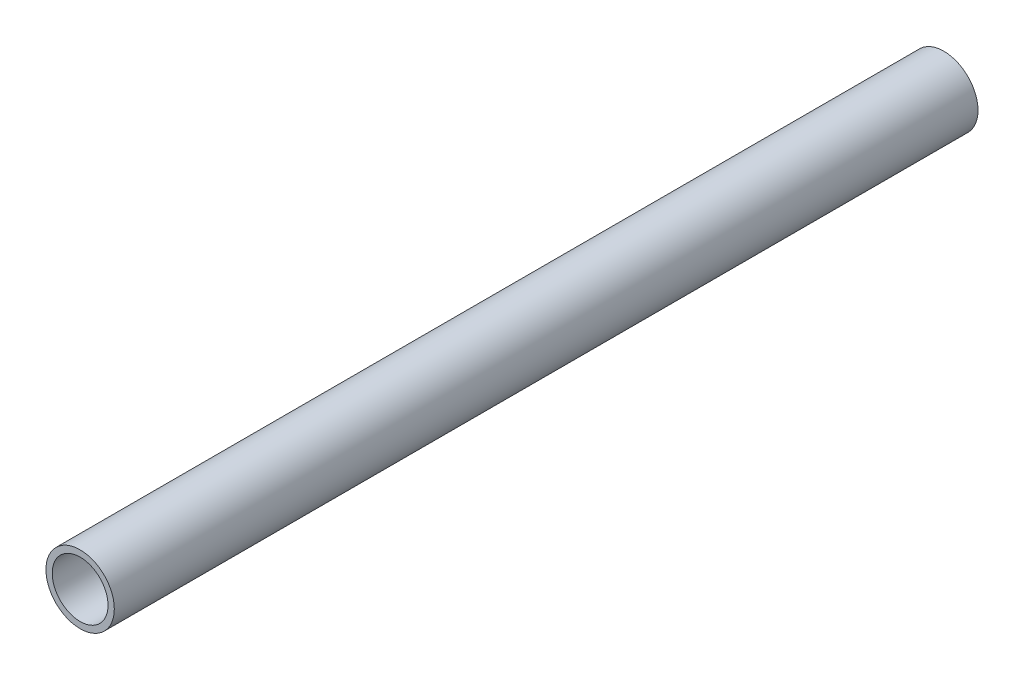
from build123d import *

# Parameters (mm, degrees)
SKETCH1_R           = 30.1625
SKETCH1_R_2         = 24.6253
EXTRUDE_THIN1_DEPTH = 762


with BuildPart() as part:
    # Sketch1 → Extrude-Thin1 (new body)
    with BuildSketch(Plane.XY):
        Circle(SKETCH1_R)
        Circle(SKETCH1_R_2, mode=Mode.SUBTRACT)
    extrude(amount=EXTRUDE_THIN1_DEPTH)


solid = part.part
